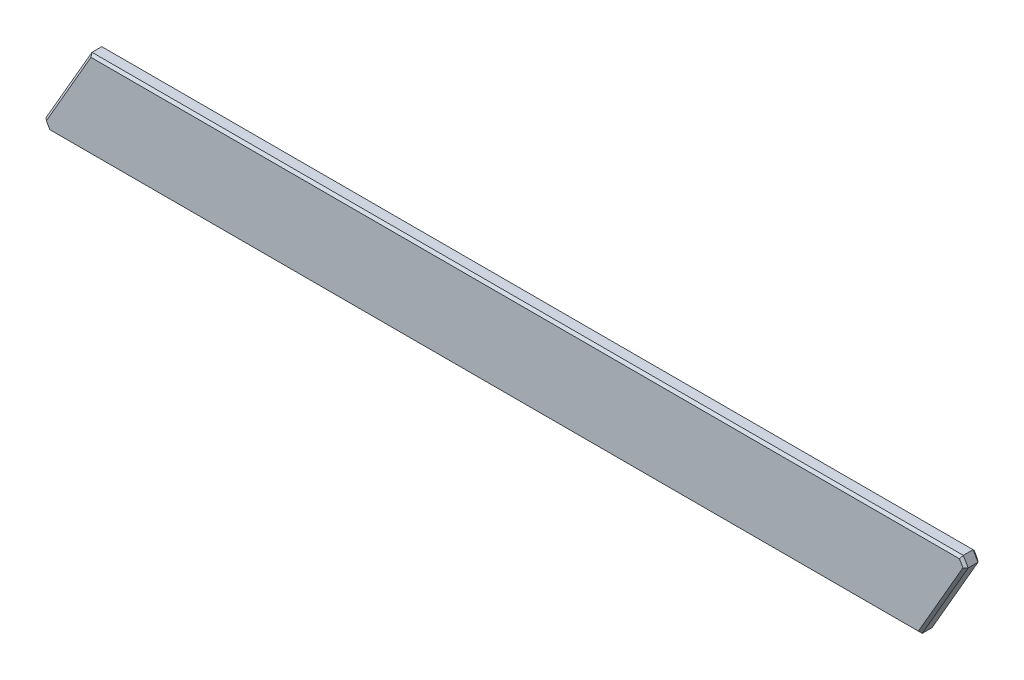
from build123d import *

# Parameters (mm, degrees)
EXTRUDE_1_DEPTH = 3
CHAMFER_1_SIZE  = 0.5


with BuildPart() as part:
    # 草图1 → 凸台-拉伸1 (new body)
    with BuildSketch(Plane.XY):
        Polygon((84.803847577, -9), (-93.196152423, -9), (-94.196152423, -7.267949192), (-84.803847577, 9), (93.196152423, 9), (94.196152423, 7.267949192), align=None)
    extrude(amount=EXTRUDE_1_DEPTH)

    # 倒角1
    chamfer_1_edges = [part.edges().sort_by_distance(p)[0] for p in [
        (93.696152423, 8.133974596, 0),
        (4.196152423, 9, 0),
        (-89.5, 0.866025404, 0),
        (-93.696152423, -8.133974596, 0),
        (-4.196152423, -9, 0),
        (89.5, -0.866025404, 0),
        (-4.196152423, -9, 3),
        (-93.696152423, -8.133974596, 3),
        (-89.5, 0.866025404, 3),
        (4.196152423, 9, 3),
        (93.696152423, 8.133974596, 3),
        (89.5, -0.866025404, 3),
    ]]
    chamfer(chamfer_1_edges, length=CHAMFER_1_SIZE)


solid = part.part
